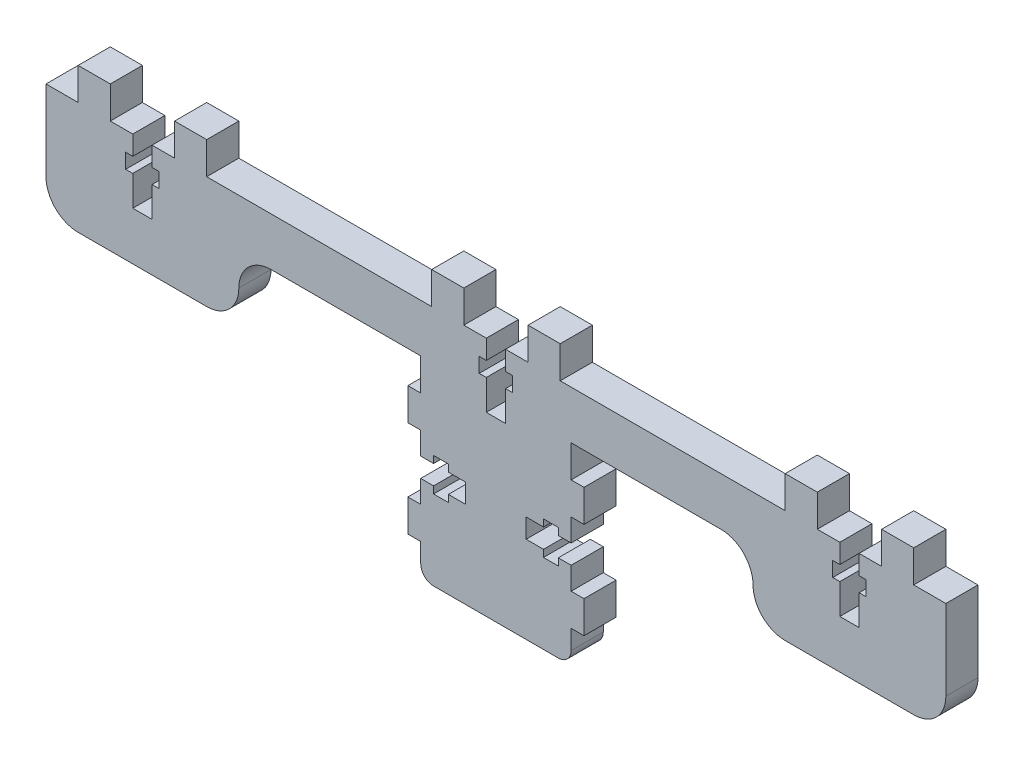
from build123d import *

# Parameters (mm, degrees)
BOSS_EXTRU_1_DEPTH = 5
CONG_1_R           = 5
FILLET1_R          = 2


with BuildPart() as part:
    # Esquisse1 → Boss.-Extru.1 (new body)
    with BuildSketch(Plane.XY):
        Polygon((25.4, 25), (23.4, 25), (23.4, 30), (51.7, 30), (51.7, 20), (81.7, 20), (81.7, 37.5), (76.7, 37.5), (76.7, 42.5), (71.7, 42.5), (71.7, 37.5), (68.2, 37.5), (68.2, 34.5), (69.3, 34.5), (69.3, 32.2), (68.2, 32.2), (68.2, 27.5), (65.2, 27.5), (65.2, 32.2), (64.1, 32.2), (64.1, 34.5), (65.2, 34.5), (65.2, 37.5), (61.7, 37.5), (61.7, 42.5), (56.7, 42.5), (56.7, 37.5), (21.7, 37.5), (21.7, 42.5), (16.7, 42.5), (16.7, 37.5), (13.2, 37.5), (13.2, 34.5), (14.3, 34.5), (14.3, 32.2), (13.2, 32.2), (13.2, 27.5), (10.2, 27.5), (10.2, 32.2), (9.1, 32.2), (9.1, 34.5), (10.2, 34.5), (10.2, 37.5), (6.7, 37.5), (6.7, 42.5), (1.7, 42.5), (1.7, 37.5), (-33.3, 37.5), (-33.3, 42.5), (-38.3, 42.5), (-38.3, 37.5), (-41.8, 37.5), (-41.8, 34.5), (-40.7, 34.5), (-40.7, 32.2), (-41.8, 32.2), (-41.8, 27.5), (-44.8, 27.5), (-44.8, 32.2), (-45.9, 32.2), (-45.9, 34.5), (-44.8, 34.5), (-44.8, 37.5), (-48.3, 37.5), (-48.3, 42.5), (-53.3, 42.5), (-53.3, 37.5), (-58.3, 37.5), (-58.3, 20), (-28.3, 20), (-28.3, 30), (0, 30), (0, 25), (-2, 25), (-2, 20), (0, 20), (0, 16.5), (2, 16.5), (2, 17.6), (4.3, 17.6), (4.3, 16.5), (7, 16.5), (7, 13.5), (4.3, 13.5), (4.3, 12.4), (2, 12.4), (2, 13.5), (0, 13.5), (0, 10), (-2, 10), (-2, 5), (0, 5), (0, 0), (23.4, 0), (23.4, 5), (25.4, 5), (25.4, 10), (23.4, 10), (23.4, 13.5), (21.4, 13.5), (21.4, 12.4), (19.1, 12.4), (19.1, 13.5), (16.4, 13.5), (16.4, 16.5), (19.1, 16.5), (19.1, 17.6), (21.4, 17.6), (21.4, 16.5), (23.4, 16.5), (23.4, 20), (25.4, 20), align=None)
    extrude(amount=BOSS_EXTRU_1_DEPTH)

    # Congé1
    cong_1_edges = [part.edges().sort_by_distance(p)[0] for p in [
        (-28.3, 30, 2.5),
        (-58.3, 20, 2.5),
        (-28.3, 20, 2.5),
        (81.7, 20, 2.5),
        (51.7, 20, 2.5),
        (51.7, 30, 2.5),
    ]]
    fillet(cong_1_edges, radius=CONG_1_R - 0.0001)  # a hair under: the kernel refuses the full size

    # Fillet1
    fillet1_edges = [part.edges().sort_by_distance(p)[0] for p in [
        (23.4, 0, 2.5),
        (0, 0, 2.5),
    ]]
    fillet(fillet1_edges, radius=FILLET1_R)


solid = part.part
